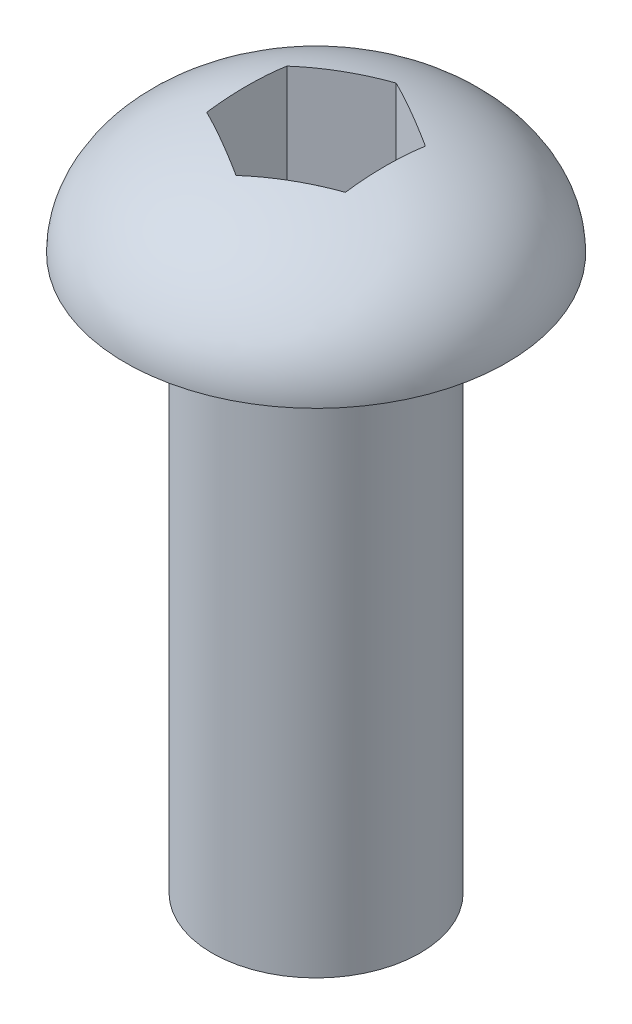
from build123d import *
from build123d.topology import SkipClean

# Parameters (mm, degrees)
SKETCH1_R           = 1.5
BOSS_EXTRUDE1_DEPTH = 8
SKETCH2_R           = 2.75
BOSS_EXTRUDE2_DEPTH = 0.1
SKETCH3_R           = 2.75
SKETCH3_R_2         = 1.5
CUT_EXTRUDE1_DEPTH  = 0.1
CUT_EXTRUDE2_DEPTH  = 2


# Read off the part's stored shape, not the designer's step: Dome1
with BuildPart() as part:
    # Sketch1 → Boss-Extrude1 (new body)
    with BuildSketch(Plane(origin=(0, 0, 0), x_dir=(1, 0, 0), z_dir=(0, 1, 0))):
        with Locations(Location((0, 0, 0), (0, 0, 270))):
            Circle(SKETCH1_R)
    extrude(amount=BOSS_EXTRUDE1_DEPTH)

    # Sketch2 → Boss-Extrude2 (add)
    with BuildSketch(Plane(origin=(0, 8, 0), x_dir=(1, 0, 0), z_dir=(0, 1, 0))):
        with Locations(Location((0, 0, 0), (0, 0, 270))):
            Circle(SKETCH2_R)
    extrude(amount=-BOSS_EXTRUDE2_DEPTH)

    # Dome1 outline → Dome1 (revolve)
    with BuildSketch(Plane.XY):
        with BuildLine():
            add(Edge.make_bspline(
                [(0, 9.7), (2.75, 9.7), (2.75, 8)],
                knots=[4.71238898, 4.71238898, 4.71238898, 6.283185307, 6.283185307, 6.283185307], degree=2, weights=[1, 0.707106781, 1]))
            Line((0, 9.7), (0, 8))
            Line((0, 8), (2.75, 8))
        make_face()
    revolve(axis=Axis((0, 0, 0), (0, 1, 0)))

    # Sketch3 → Cut-Extrude1 (cut)
    with SkipClean():  # the faces are left unmerged after this step: merging them gives an invalid solid
        with BuildSketch(Plane.XZ.offset(-7.9)):
            Circle(SKETCH3_R)
            with Locations(Location((0, 0, 0), (0, 0, 270))):
                Circle(SKETCH3_R_2, mode=Mode.SUBTRACT)
        extrude(amount=-CUT_EXTRUDE1_DEPTH, mode=Mode.SUBTRACT)

    # Sketch4 → Cut-Extrude2 (cut)
    with SkipClean():  # the faces are left unmerged after this step: merging them gives an invalid solid
        with BuildSketch(Plane(origin=(0, 9.7, 0), x_dir=(1, 0, 0), z_dir=(0, 1, 0))):
            Polygon((0, 1.154700538), (-1, 0.577350269), (-1, -0.577350269), (0, -1.154700538), (1, -0.577350269), (1, 0.577350269), align=None)
        extrude(amount=-CUT_EXTRUDE2_DEPTH, mode=Mode.SUBTRACT)


solid = part.part
